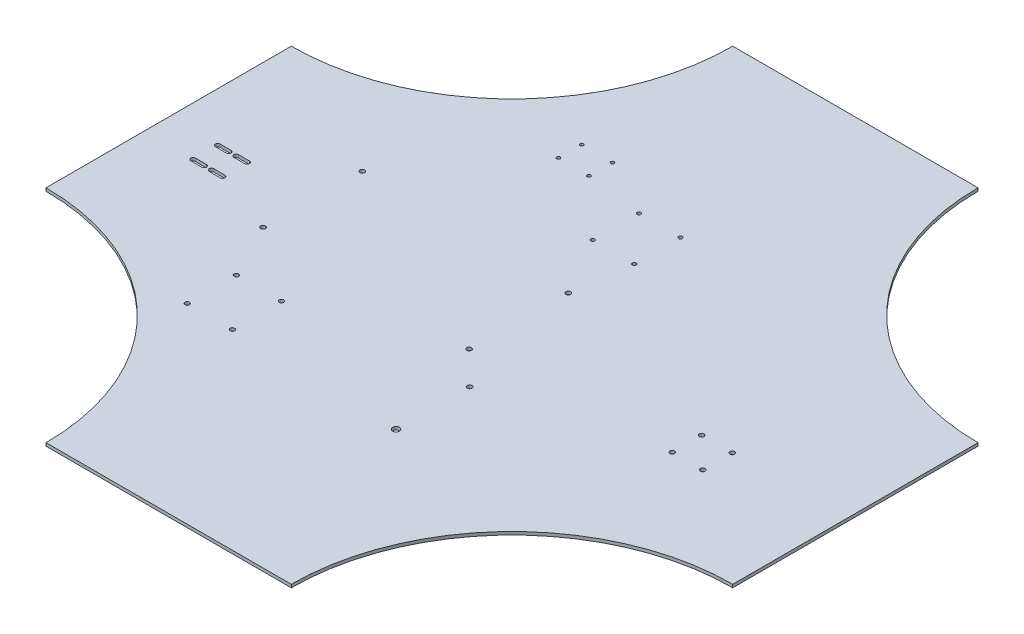
from build123d import *

# Parameters (mm, degrees)
BOSS_EXTRUDE1_DEPTH     = 3.175
CUT_EXTRUDE1_DEPTH      = 503.904365287
CUT_EXTRUDE1_DEPTH_BACK = 503.904365287
SKETCH4_R               = 2.413
CUT_EXTRUDE2_DEPTH      = 503.904365287
SKETCH5_R               = 2.5
SKETCH5_R_2             = 2.47796547
CUT_EXTRUDE3_DEPTH      = 503.904365287
SKETCH6_R               = 2.321781934
SKETCH6_R_2             = 3.504485203
SKETCH6_R_3             = 2.5
SKETCH6_R_4             = 1.905
SKETCH6_R_5             = 1.75
CUT_EXTRUDE4_DEPTH      = 503.904365287


with BuildPart() as part:
    # Sketch1 → Boss-Extrude1 (new body)
    with BuildSketch(Plane(origin=(0, 0, 0), x_dir=(1, 0, 0), z_dir=(0, 1, 0))):
        with BuildLine():
            Line((-127, -355.6), (127, -355.6))
            ThreePointArc((127, -355.6), (193.955389821, -193.955389821), (355.6, -127))
            Line((355.6, -127), (355.6, 127))
            ThreePointArc((355.6, 127), (193.955389821, 193.955389821), (127, 355.6))
            Line((127, 355.6), (-127, 355.6))
            ThreePointArc((-127, 355.6), (-193.955389821, 193.955389821), (-355.6, 127))
            Line((-355.6, 127), (-355.6, -127))
            ThreePointArc((-355.6, -127), (-193.955389821, -193.955389821), (-127, -355.6))
        make_face()
    extrude(amount=BOSS_EXTRUDE1_DEPTH)

    # Sketch2 → Cut-Extrude1 (cut, two sides: drawn at the far end of the back side and taken through both)
    with BuildSketch(Plane(origin=(0, 3.175, 0), x_dir=(1, 0, 0), z_dir=(0, 1, 0)).offset(-CUT_EXTRUDE1_DEPTH_BACK)):
        with BuildLine():
            Line((-304.8, 2.413), (-293.37, 2.413))
            ThreePointArc((-293.37, 2.413), (-290.957, 0), (-293.37, -2.413))
            Line((-293.37, -2.413), (-304.8, -2.413))
            ThreePointArc((-304.8, -2.413), (-307.213, 0), (-304.8, 2.413))
        make_face()
        with BuildLine():
            Line((-304.8, -22.987), (-293.37, -22.987))
            ThreePointArc((-293.37, -22.987), (-290.957, -25.4), (-293.37, -27.813))
            Line((-293.37, -27.813), (-304.8, -27.813))
            ThreePointArc((-304.8, -27.813), (-307.213, -25.4), (-304.8, -22.987))
        make_face()
        with BuildLine():
            Line((-285.75, -2.413), (-274.32, -2.413))
            ThreePointArc((-274.32, -2.413), (-271.907, 0), (-274.32, 2.413))
            Line((-274.32, 2.413), (-285.75, 2.413))
            ThreePointArc((-285.75, 2.413), (-288.163, 0), (-285.75, -2.413))
        make_face()
        with BuildLine():
            Line((-285.75, -22.987), (-274.32, -22.987))
            ThreePointArc((-274.32, -22.987), (-271.907, -25.4), (-274.32, -27.813))
            Line((-274.32, -27.813), (-285.75, -27.813))
            ThreePointArc((-285.75, -27.813), (-288.163, -25.4), (-285.75, -22.987))
        make_face()
    extrude(amount=CUT_EXTRUDE1_DEPTH + CUT_EXTRUDE1_DEPTH_BACK, mode=Mode.SUBTRACT)

    # Sketch4 → Cut-Extrude2 (cut, through all)
    with BuildSketch(Plane(origin=(0, 3.175, 0), x_dir=(1, 0, 0), z_dir=(0, 1, 0))):
        with Locations((237.49, -9.430177049)):
            Circle(SKETCH4_R)
        with Locations((205.74, -9.430177049)):
            Circle(SKETCH4_R)
        with Locations((237.49, -39.910177049)):
            Circle(SKETCH4_R)
        with Locations((205.74, -39.910177049)):
            Circle(SKETCH4_R)
    extrude(amount=-CUT_EXTRUDE2_DEPTH, mode=Mode.SUBTRACT)

    # Sketch5 → Cut-Extrude3 (cut, through all)
    with BuildSketch(Plane.XZ):
        with Locations((-207.790149601, 50.01656837)):
            Circle(SKETCH5_R)
        with Locations((-206.624048203, -51.576739518)):
            Circle(SKETCH5_R)
        with Locations((8.09562966, 52.494533839)):
            Circle(SKETCH5_R_2)
        with Locations((9.261731058, -49.098774048)):
            Circle(SKETCH5_R)
    extrude(amount=-CUT_EXTRUDE3_DEPTH, mode=Mode.SUBTRACT)

    # Sketch6 → Cut-Extrude4 (cut, through all)
    with BuildSketch(Plane.XZ):
        with Locations((-131.96570437, 157.594741445)):
            Circle(SKETCH6_R)
        with Locations((-131.96570437, 106.794741445)):
            Circle(SKETCH6_R)
        with Locations((-178.700591901, 106.794741445)):
            Circle(SKETCH6_R)
        with Locations((-178.700591901, 157.594741445)):
            Circle(SKETCH6_R)
        with Locations((42.265908941, 162.337536061)):
            Circle(SKETCH6_R_2)
        with Locations((42.265908941, 86.137536061)):
            Circle(SKETCH6_R_3)
        with Locations((17.371687145, -109.265722508)):
            Circle(SKETCH6_R_4)
        with Locations((-25.681149945, -109.384160374)):
            Circle(SKETCH6_R_4)
        with Locations((-25.549785233, -157.135979683)):
            Circle(SKETCH6_R_4)
        with Locations((17.503045383, -157.015188359)):
            Circle(SKETCH6_R_4)
        with Locations((-84.882409293, -188.871278488)):
            Circle(SKETCH6_R_5)
        with Locations((-85.091846145, -164.872192335)):
            Circle(SKETCH6_R_5)
        with Locations((-116.881190831, -189.150527624)):
            Circle(SKETCH6_R_5)
        with Locations((-117.090627683, -165.151441471)):
            Circle(SKETCH6_R_5)
    extrude(amount=-CUT_EXTRUDE4_DEPTH, mode=Mode.SUBTRACT)


solid = part.part
